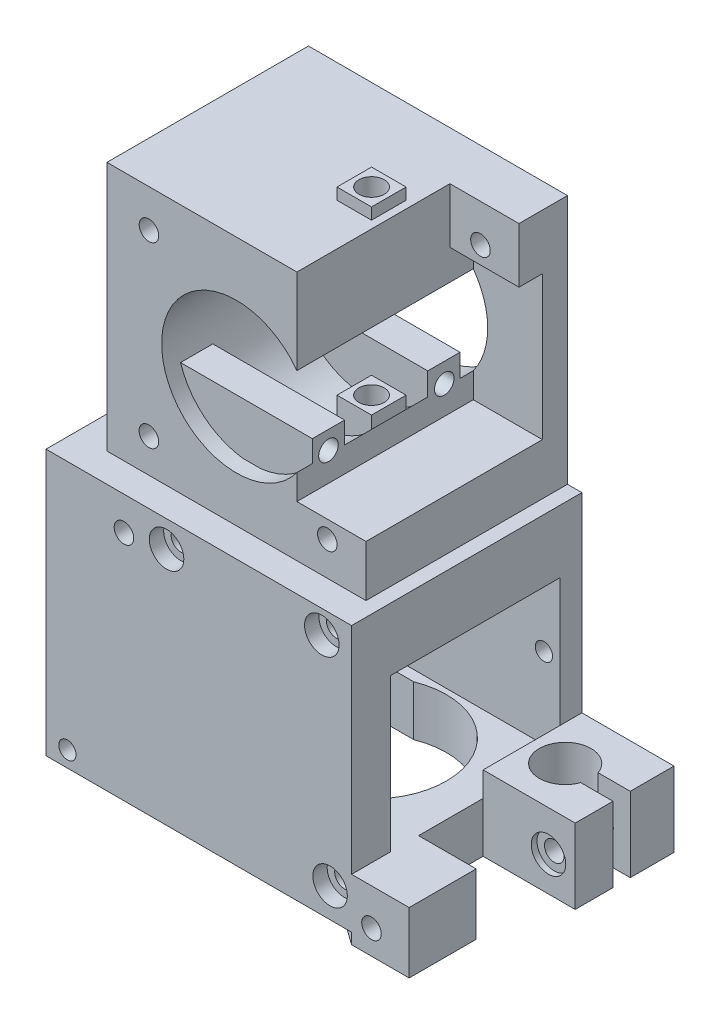
from build123d import *
from OCP.BRepAlgoAPI import BRepAlgoAPI_Cut
from OCP.TopTools import TopTools_ListOfShape

# Parameters (mm, degrees)
SKETCH1_W                     = 45
SKETCH1_H                     = 45
BOSS_EXTRUDE1_DEPTH           = 35
SKETCH2_R                     = 13
CUT_EXTRUDE3_DEPTH            = 35
SKETCH4_R                     = 1.7
CUT_EXTRUDE8_DEPTH            = 35
SKETCH7_R                     = 1.7
CUT_EXTRUDE9_DEPTH            = 35
SKETCH6_R                     = 1.7
CUT_EXTRUDE10_DEPTH           = 35
SKETCH5_R                     = 1.7
CUT_EXTRUDE11_DEPTH           = 35
CUT_EXTRUDE12_DEPTH           = 12
BOSS_EXTRUDE4_DEPTH           = 2
BOSS_EXTRUDE4_DEPTH_BACK      = 37.5
SKETCH14_W                    = 6
SKETCH14_H                    = 6
CUT_EXTRUDE17_START           = -7
SKETCH20_R                    = 2.2
CUT_EXTRUDE17_DEPTH           = 70.77141069
SKETCH21_R                    = 1.75
CUT_EXTRUDE18_DEPTH           = 2
BOSS_EXTRUDE5_DEPTH           = 44.571207257
BOSS_EXTRUDE5_DEPTH_BACK      = 1.562633388
SKETCH22_W                    = 53.082637552
SKETCH22_H                    = 40.002520942
SKETCH23_W                    = 29.449729346
SKETCH23_H                    = 26.517519529
CUT_EXTRUDE19_DEPTH           = 95.427299018
SKETCH25_R                    = 5
CUT_EXTRUDE24_DEPTH           = 2.6
SKETCH26_R                    = 8.1
CUT_EXTRUDE25_DEPTH           = 4
SKETCH27_R                    = 6.7
CUT_EXTRUDE28_DEPTH           = 6
SKETCH30_R                    = 13
CUT_EXTRUDE30_DEPTH           = 10.767560088
SKETCH31_W                    = 19.349450051
SKETCH31_H                    = 23.644133728
CUT_EXTRUDE31_DEPTH           = 9.664293754
SKETCH34_R                    = 1.5
CUT_EXTRUDE32_DEPTH           = 9
SKETCH37_W                    = 11.635024897
SKETCH37_H                    = 10.599921236
BOSS_EXTRUDE6_DEPTH           = 10
BOSS_EXTRUDE6_OTHER_WAY_DEPTH = 5
BOSS_EXTRUDE6_OTHER_WAY_TAPER = 29
SKETCH38_R                    = 1.7
CUT_EXTRUDE33_DEPTH           = 10
SKETCH39_R                    = 1.7
CUT_EXTRUDE34_DEPTH           = 88.0662855
SKETCH40_W                    = 17.159872711
SKETCH40_H                    = 13
BOSS_EXTRUDE7_DEPTH           = 16
SKETCH41_R                    = 4.5
CUT_EXTRUDE35_DEPTH           = 15
SKETCH42_W                    = 9.331425876
SKETCH42_H                    = 3
CUT_EXTRUDE36_DEPTH           = 15
CUT_EXTRUDE37_DEPTH           = 5
SKETCH44_R                    = 1.7
CUT_EXTRUDE38_DEPTH           = 23
CUT_EXTRUDE39_DEPTH           = 5
CUT_EXTRUDE40_DEPTH           = 5
CUT_EXTRUDE41_DEPTH           = 5
SKETCH53_R                    = 1.7
CUT_EXTRUDE42_DEPTH           = 90.646740997
SKETCH52_R                    = 1.7
CUT_EXTRUDE43_DEPTH           = 90.646740997
SKETCH51_R                    = 1.7
CUT_EXTRUDE44_DEPTH           = 90.646740997
CUT_EXTRUDE46_DEPTH           = 5
SKETCH57_R                    = 3
CUT_EXTRUDE48_DEPTH           = 2.5
SKETCH58_R                    = 3
CUT_EXTRUDE49_DEPTH           = 2.5
SKETCH59_R                    = 3
CUT_EXTRUDE50_DEPTH           = 2.5
SKETCH60_R                    = 3
CUT_EXTRUDE51_DEPTH           = 1
SKETCH61_W                    = 6.542017971
SKETCH61_H                    = 14.030300317
CUT_EXTRUDE52_DEPTH           = 6.5
SKETCH67_W                    = 5.604230097
SKETCH67_H                    = 8.996545788
BOSS_EXTRUDE8_DEPTH           = 33
SKETCH68_W                    = 5.604230097
SKETCH68_H                    = 9.400155495
BOSS_EXTRUDE9_DEPTH           = 33
SKETCH63_R                    = 1.7
CUT_EXTRUDE55_DEPTH           = 102.92049818
SKETCH62_R                    = 1.7
CUT_EXTRUDE56_DEPTH           = 102.92049818
SKETCH69_R                    = 3
CUT_EXTRUDE57_DEPTH           = 2.5
CUT_EXTRUDE58_DEPTH           = 2.5
SKETCH71_R                    = 3
CUT_EXTRUDE59_DEPTH           = 1
SKETCH72_R                    = 1.5
CUT_EXTRUDE60_DEPTH           = 5
SKETCH73_R                    = 1.5
CUT_EXTRUDE61_DEPTH           = 5


with BuildPart() as part:
    # Sketch1 → Boss-Extrude1 (new body)
    with BuildSketch(Plane.XY):
        Rectangle(SKETCH1_W, SKETCH1_H)
    extrude(amount=BOSS_EXTRUDE1_DEPTH)

    # Sketch2 → Cut-Extrude3 (cut)
    with BuildSketch(Plane.XY.offset(35)):
        Circle(SKETCH2_R)
    extrude(amount=-CUT_EXTRUDE3_DEPTH, mode=Mode.SUBTRACT)

    # Sketch4 → Cut-Extrude8 (cut)
    with BuildSketch(Plane(origin=(0, 0, 0), x_dir=(-1, 0, 0), z_dir=(0, 0, -1))):
        with Locations((-15.808862622, 15.928817575)):
            Circle(SKETCH4_R)
    extrude(amount=-CUT_EXTRUDE8_DEPTH, mode=Mode.SUBTRACT)

    # Sketch7 → Cut-Extrude9 (cut)
    with BuildSketch(Plane(origin=(0, 0, 0), x_dir=(-1, 0, 0), z_dir=(0, 0, -1))):
        with Locations((15.199970606, 15.923392722)):
            Circle(SKETCH7_R)
    extrude(amount=-CUT_EXTRUDE9_DEPTH, mode=Mode.SUBTRACT)

    # Sketch6 → Cut-Extrude10 (cut)
    with BuildSketch(Plane(origin=(0, 0, 0), x_dir=(-1, 0, 0), z_dir=(0, 0, -1))):
        with Locations((15.22029943, -15.065721832)):
            Circle(SKETCH6_R)
    extrude(amount=-CUT_EXTRUDE10_DEPTH, mode=Mode.SUBTRACT)

    # Sketch5 → Cut-Extrude11 (cut)
    with BuildSketch(Plane(origin=(0, 0, 0), x_dir=(-1, 0, 0), z_dir=(0, 0, -1))):
        with Locations((-15.781319068, -15.06525873)):
            Circle(SKETCH5_R)
    extrude(amount=-CUT_EXTRUDE11_DEPTH, mode=Mode.SUBTRACT)

    # Sketch8 → Cut-Extrude12 (cut)
    with BuildSketch(Plane(origin=(22.5, 0, 0), x_dir=(0, 0, -1), z_dir=(1, 0, 0))):
        Polygon((-4.363915061, -12.036124724), (-35, -12.036124724), (-35, 22.5), (-8.423058519, 22.5), (-8.423058519, 12.925541512), (-4.363915061, 12.925541512), align=None)
    extrude(amount=-CUT_EXTRUDE12_DEPTH, mode=Mode.SUBTRACT)

    # Sketch14 → Boss-Extrude4 (add, two sides: drawn at the far end of the back side and taken through both)
    with BuildSketch(Plane(origin=(0, 22.5, 0), x_dir=(1, 0, 0), z_dir=(0, 1, 0)).offset(-BOSS_EXTRUDE4_DEPTH_BACK)):
        with Locations((6.190916669, -17.729312446)):
            Rectangle(SKETCH14_W, SKETCH14_H)
    extrude(amount=BOSS_EXTRUDE4_DEPTH + BOSS_EXTRUDE4_DEPTH_BACK)

    # Sketch20 → Cut-Extrude17 (cut)
    with BuildSketch(Plane(origin=(0, 24.5, 0), x_dir=(1, 0, 0), z_dir=(0, 1, 0)).offset(CUT_EXTRUDE17_START)):
        with Locations((6.190916669, -17.729312446)):
            Circle(SKETCH20_R)
    cut_extrude17 = extrude(amount=CUT_EXTRUDE17_DEPTH, mode=Mode.SUBTRACT)

    # Sketch21 → Cut-Extrude18 (cut)
    with BuildSketch(Plane(origin=(0, 17.5, 0), x_dir=(1, 0, 0), z_dir=(0, 1, 0))):
        with Locations((6.190916669, -17.729312446)):
            Circle(SKETCH21_R)
    extrude(amount=-CUT_EXTRUDE18_DEPTH, mode=Mode.SUBTRACT)

    # Mirror6: Cut-Extrude17 across plane
    add(cut_extrude17.mirror(Plane.ZX.offset(16.5)), mode=Mode.SUBTRACT)

    # Sketch22 → Boss-Extrude5 (add, two sides: drawn at the far end of the back side and taken through both)
    with BuildSketch(Plane.XZ.offset(22.5).offset(-BOSS_EXTRUDE5_DEPTH_BACK)):
        with Locations((-1.541318776, 20.001258793)):
            Rectangle(SKETCH22_W, SKETCH22_H)
    extrude(amount=BOSS_EXTRUDE5_DEPTH + BOSS_EXTRUDE5_DEPTH_BACK)

    # Sketch23 → Cut-Extrude19 (cut, through all)
    with BuildSketch(Plane.ZY.offset(28.082637552)):
        with Locations((18.529138975, -45.100264067)):
            Rectangle(SKETCH23_W, SKETCH23_H)
    extrude(amount=-CUT_EXTRUDE19_DEPTH, mode=Mode.SUBTRACT)

    # Sketch25 → Cut-Extrude24 (cut)
    with BuildSketch(Plane(origin=(0, -20.937366612, 0), x_dir=(1, 0, 0), z_dir=(0, 1, 0))):
        with Locations((6.190916669, -17.729312446)):
            Circle(SKETCH25_R)
    extrude(amount=-CUT_EXTRUDE24_DEPTH, mode=Mode.SUBTRACT)

    # Sketch26 → Cut-Extrude25 (cut)
    with BuildSketch(Plane(origin=(0, -23.537366612, 0), x_dir=(1, 0, 0), z_dir=(0, 1, 0))):
        with Locations((6.190916669, -17.729312446)):
            Circle(SKETCH26_R)
    extrude(amount=-CUT_EXTRUDE25_DEPTH, mode=Mode.SUBTRACT)

    # Sketch27 → Cut-Extrude28 (cut)
    with BuildSketch(Plane(origin=(0, -27.537366612, 0), x_dir=(1, 0, 0), z_dir=(0, 1, 0))):
        with Locations((6.190916669, -17.729312446)):
            Circle(SKETCH27_R)
    extrude(amount=-CUT_EXTRUDE28_DEPTH, mode=Mode.SUBTRACT)

    # Sketch30 → Cut-Extrude30 (cut)
    with BuildSketch(Plane(origin=(0, -58.359023831, 0), x_dir=(1, 0, 0), z_dir=(0, 1, 0))):
        with Locations((6.207851035, -17.729312446)):
            Circle(SKETCH30_R)
    extrude(amount=-CUT_EXTRUDE30_DEPTH, mode=Mode.SUBTRACT)

    # Sketch31 → Cut-Extrude31 (cut)
    with BuildSketch(Plane.XZ.offset(67.071207257)):
        with Locations((-7.592166715, 17.462222744)):
            Rectangle(SKETCH31_W, SKETCH31_H)
    extrude(amount=-CUT_EXTRUDE31_DEPTH, mode=Mode.SUBTRACT)

    # Sketch34 → Cut-Extrude32 (cut)
    with BuildSketch(Plane.ZY.offset(28.082637552)):
        with Locations((35.530918006, -28.494957131)):
            Circle(SKETCH34_R)
        with Locations((3.530918006, -28.494957131)):
            Circle(SKETCH34_R)
        with Locations((35.530918006, -60.494957131)):
            Circle(SKETCH34_R)
        with Locations((3.530918006, -60.494957131)):
            Circle(SKETCH34_R)
    extrude(amount=-CUT_EXTRUDE32_DEPTH, mode=Mode.SUBTRACT)

    # Sketch37 → Boss-Extrude6 (add)
    with BuildSketch(Plane(origin=(25, 0, 0), x_dir=(0, 0, -1), z_dir=(1, 0, 0))):
        with Locations((-34.185004037, -63.658986353)):
            Rectangle(SKETCH37_W, SKETCH37_H)
    extrude(amount=BOSS_EXTRUDE6_DEPTH)

    # Sketch37 → Boss-Extrude6 other way (add)
    with BuildSketch(Plane(origin=(25, 0, 0), x_dir=(0, 0, -1), z_dir=(1, 0, 0))):
        with Locations((-34.185004037, -63.658986353)):
            Rectangle(SKETCH37_W, SKETCH37_H)
    extrude(amount=-BOSS_EXTRUDE6_OTHER_WAY_DEPTH, taper=BOSS_EXTRUDE6_OTHER_WAY_TAPER)

    # Sketch38 → Cut-Extrude33 (cut)
    with BuildSketch(Plane.XY.offset(40.002519264)):
        with Locations((28.454234577, -64.748396148)):
            Circle(SKETCH38_R)
    extrude(amount=-CUT_EXTRUDE33_DEPTH, mode=Mode.SUBTRACT)

    # Sketch39 → Cut-Extrude34 (cut, through all)
    with BuildSketch(Plane.XY.offset(40.002519264)):
        with Locations((-14.545765423, -26.748396148)):
            Circle(SKETCH39_R)
    extrude(amount=-CUT_EXTRUDE34_DEPTH, mode=Mode.SUBTRACT)

    # Sketch40 → Boss-Extrude7 (add)
    with BuildSketch(Plane(origin=(25, 0, 0), x_dir=(0, 0, -1), z_dir=(1, 0, 0))):
        with Locations((-8.579933523, -60.571207257)):
            Rectangle(SKETCH40_W, SKETCH40_H)
    extrude(amount=BOSS_EXTRUDE7_DEPTH)

    # Sketch41 → Cut-Extrude35 (cut)
    with BuildSketch(Plane(origin=(0, -54.071207257, 1.269334023), x_dir=(1, 0, 0), z_dir=(0, 1, 0))):
        with Locations((31.163890056, -7.793414205)):
            Circle(SKETCH41_R)
    extrude(amount=-CUT_EXTRUDE35_DEPTH, mode=Mode.SUBTRACT)

    # Sketch42 → Cut-Extrude36 (cut)
    with BuildSketch(Plane(origin=(0, -54.071207257, 0), x_dir=(1, 0, 0), z_dir=(0, 1, 0))):
        with Locations((38.19390682, -9.095710432)):
            Rectangle(SKETCH42_W, SKETCH42_H)
    extrude(amount=-CUT_EXTRUDE36_DEPTH, mode=Mode.SUBTRACT)


with BuildPart() as cut_extrude37_tool:
    # Sketch43 → Cut-Extrude37 (new body)
    with BuildSketch(Plane(origin=(0, 0, 0), x_dir=(-1, 0, 0), z_dir=(0, 0, -1))):
        Polygon((-34.628927379, -64.403909926), (-32.738460245, -61.095415705), (-34.658466721, -57.80397603), (-38.468940333, -57.821030577), (-40.359407467, -61.129524799), (-38.439400991, -64.420964473), align=None)
    extrude(amount=-CUT_EXTRUDE37_DEPTH)


with BuildPart() as part_1:
    add(part.part)

    # Cut-Extrude37: cut by cut_extrude37_tool, with a tolerance
    cut_extrude37_stock = TopTools_ListOfShape()
    cut_extrude37_stock.Append(part_1.part.wrapped)
    cut_extrude37_tools = TopTools_ListOfShape()
    cut_extrude37_tools.Append(cut_extrude37_tool.part.wrapped)
    cut_extrude37_cut = BRepAlgoAPI_Cut()
    cut_extrude37_cut.SetArguments(cut_extrude37_stock)
    cut_extrude37_cut.SetTools(cut_extrude37_tools)
    cut_extrude37_cut.SetFuzzyValue(0.00001)
    cut_extrude37_cut.Build()
    add(Compound.cast(cut_extrude37_cut.Shape()).solids(), mode=Mode.REPLACE)

    # Sketch44 → Cut-Extrude38 (cut)
    with BuildSketch(Plane.XY.offset(17.159869878)):
        with Locations((36.360549159, -61.087091915)):
            Circle(SKETCH44_R)
    extrude(amount=-CUT_EXTRUDE38_DEPTH, mode=Mode.SUBTRACT)


with BuildPart() as cut_extrude39_tool:
    # Sketch48 → Cut-Extrude39 (new body)
    with BuildSketch(Plane(origin=(0, 0, 0), x_dir=(-1, 0, 0), z_dir=(0, 0, -1))):
        Polygon((9.066729233, -28.811078933), (10.957196368, -25.502584711), (9.037189891, -22.211145037), (5.22671628, -22.228199584), (3.336249145, -25.536693806), (5.256255622, -28.82813348), align=None)
    extrude(amount=-CUT_EXTRUDE39_DEPTH)


with BuildPart() as part_2:
    add(part_1.part)

    # Cut-Extrude39: cut by cut_extrude39_tool, with a tolerance
    cut_extrude39_stock = TopTools_ListOfShape()
    cut_extrude39_stock.Append(part_2.part.wrapped)
    cut_extrude39_tools = TopTools_ListOfShape()
    cut_extrude39_tools.Append(cut_extrude39_tool.part.wrapped)
    cut_extrude39_cut = BRepAlgoAPI_Cut()
    cut_extrude39_cut.SetArguments(cut_extrude39_stock)
    cut_extrude39_cut.SetTools(cut_extrude39_tools)
    cut_extrude39_cut.SetFuzzyValue(0.00001)
    cut_extrude39_cut.Build()
    add(Compound.cast(cut_extrude39_cut.Shape()).solids(), mode=Mode.REPLACE)


with BuildPart() as cut_extrude40_tool:
    # Sketch49 → Cut-Extrude40 (new body)
    with BuildSketch(Plane(origin=(0, 0, 0), x_dir=(-1, 0, 0), z_dir=(0, 0, -1))):
        Polygon((-19.339505263, -65.26594849), (-17.449038128, -61.957454268), (-19.369044605, -58.666014594), (-23.179518216, -58.683069141), (-25.06998535, -61.991563363), (-23.149978874, -65.283003037), align=None)
    extrude(amount=-CUT_EXTRUDE40_DEPTH)


with BuildPart() as part_3:
    add(part_2.part)

    # Cut-Extrude40: cut by cut_extrude40_tool, with a tolerance
    cut_extrude40_stock = TopTools_ListOfShape()
    cut_extrude40_stock.Append(part_3.part.wrapped)
    cut_extrude40_tools = TopTools_ListOfShape()
    cut_extrude40_tools.Append(cut_extrude40_tool.part.wrapped)
    cut_extrude40_cut = BRepAlgoAPI_Cut()
    cut_extrude40_cut.SetArguments(cut_extrude40_stock)
    cut_extrude40_cut.SetTools(cut_extrude40_tools)
    cut_extrude40_cut.SetFuzzyValue(0.00001)
    cut_extrude40_cut.Build()
    add(Compound.cast(cut_extrude40_cut.Shape()).solids(), mode=Mode.REPLACE)


with BuildPart() as cut_extrude41_tool:
    # Sketch50 → Cut-Extrude41 (new body)
    with BuildSketch(Plane(origin=(0, 0, 0), x_dir=(-1, 0, 0), z_dir=(0, 0, -1))):
        Polygon((-17.911640095, -28.243498116), (-16.02117296, -24.935003895), (-17.941179437, -21.64356422), (-21.751653048, -21.660618767), (-23.642120183, -24.969112989), (-21.722113706, -28.260552663), align=None)
    extrude(amount=-CUT_EXTRUDE41_DEPTH)


with BuildPart() as part_4:
    add(part_3.part)

    # Cut-Extrude41: cut by cut_extrude41_tool, with a tolerance
    cut_extrude41_stock = TopTools_ListOfShape()
    cut_extrude41_stock.Append(part_4.part.wrapped)
    cut_extrude41_tools = TopTools_ListOfShape()
    cut_extrude41_tools.Append(cut_extrude41_tool.part.wrapped)
    cut_extrude41_cut = BRepAlgoAPI_Cut()
    cut_extrude41_cut.SetArguments(cut_extrude41_stock)
    cut_extrude41_cut.SetTools(cut_extrude41_tools)
    cut_extrude41_cut.SetFuzzyValue(0.00001)
    cut_extrude41_cut.Build()
    add(Compound.cast(cut_extrude41_cut.Shape()).solids(), mode=Mode.REPLACE)

    # Sketch53 → Cut-Extrude42 (cut, through all)
    with BuildSketch(Plane.XY.offset(40.002519264)):
        with Locations((21.259511739, -61.974508816)):
            Circle(SKETCH53_R)
    extrude(amount=-CUT_EXTRUDE42_DEPTH, mode=Mode.SUBTRACT)

    # Sketch52 → Cut-Extrude43 (cut, through all)
    with BuildSketch(Plane.XY.offset(40.002519264)):
        with Locations((19.831646572, -24.952058442)):
            Circle(SKETCH52_R)
    extrude(amount=-CUT_EXTRUDE43_DEPTH, mode=Mode.SUBTRACT)

    # Sketch51 → Cut-Extrude44 (cut, through all)
    with BuildSketch(Plane.XY.offset(40.002519264)):
        with Locations((-7.146722757, -25.519639258)):
            Circle(SKETCH51_R)
    extrude(amount=-CUT_EXTRUDE44_DEPTH, mode=Mode.SUBTRACT)


with BuildPart() as cut_extrude46_tool:
    # Sketch55 → Cut-Extrude46 (new body)
    with BuildSketch(Plane(origin=(0, 0, 0), x_dir=(-1, 0, 0), z_dir=(0, 0, -1))):
        Polygon((16.584868726, -29.967411171), (18.35306586, -26.591988399), (16.313962558, -23.372973375), (12.506662121, -23.529381124), (10.738464986, -26.904803896), (12.777568289, -30.12381892), align=None)
    extrude(amount=-CUT_EXTRUDE46_DEPTH)


with BuildPart() as part_5:
    add(part_4.part)

    # Cut-Extrude46: cut by cut_extrude46_tool, with a tolerance
    cut_extrude46_stock = TopTools_ListOfShape()
    cut_extrude46_stock.Append(part_5.part.wrapped)
    cut_extrude46_tools = TopTools_ListOfShape()
    cut_extrude46_tools.Append(cut_extrude46_tool.part.wrapped)
    cut_extrude46_cut = BRepAlgoAPI_Cut()
    cut_extrude46_cut.SetArguments(cut_extrude46_stock)
    cut_extrude46_cut.SetTools(cut_extrude46_tools)
    cut_extrude46_cut.SetFuzzyValue(0.00001)
    cut_extrude46_cut.Build()
    add(Compound.cast(cut_extrude46_cut.Shape()).solids(), mode=Mode.REPLACE)

    # Sketch57 → Cut-Extrude48 (cut)
    with BuildSketch(Plane.XY.offset(40.002519264)):
        with Locations((-7.146722757, -25.519639258)):
            Circle(SKETCH57_R)
    extrude(amount=-CUT_EXTRUDE48_DEPTH, mode=Mode.SUBTRACT)

    # Sketch58 → Cut-Extrude49 (cut)
    with BuildSketch(Plane.XY.offset(40.002519264)):
        with Locations((19.831646572, -24.952058442)):
            Circle(SKETCH58_R)
    extrude(amount=-CUT_EXTRUDE49_DEPTH, mode=Mode.SUBTRACT)

    # Sketch59 → Cut-Extrude50 (cut)
    with BuildSketch(Plane.XY.offset(40.002519264)):
        with Locations((21.259511739, -61.974508816)):
            Circle(SKETCH59_R)
    extrude(amount=-CUT_EXTRUDE50_DEPTH, mode=Mode.SUBTRACT)

    # Sketch60 → Cut-Extrude51 (cut)
    with BuildSketch(Plane(origin=(0, 0, 0), x_dir=(-1, 0, 0), z_dir=(0, 0, -1))):
        with Locations((-15.808862622, 15.928817575)):
            Circle(SKETCH60_R)
        with Locations((15.199970606, 15.923392722)):
            Circle(SKETCH60_R)
        with Locations((-15.781319068, -15.06525873)):
            Circle(SKETCH60_R)
        with Locations((15.22029943, -15.065721832)):
            Circle(SKETCH60_R)
    extrude(amount=-CUT_EXTRUDE51_DEPTH, mode=Mode.SUBTRACT)

    # Sketch61 → Cut-Extrude52 (cut)
    with BuildSketch(Plane(origin=(9.190916669, 0, 0), x_dir=(0, 0, -1), z_dir=(1, 0, 0))):
        with Locations((-17.812553374, 0.202623489)):
            Rectangle(SKETCH61_W, SKETCH61_H)
    extrude(amount=-CUT_EXTRUDE52_DEPTH, mode=Mode.SUBTRACT)

    # Sketch67 → Boss-Extrude8 (add)
    with BuildSketch(Plane(origin=(-22.5, -2.468350024, 0), x_dir=(0, 0, 1), z_dir=(-1, 0, 0))):
        with Locations((29.51622543, -5.940778019)):
            Rectangle(SKETCH67_W, SKETCH67_H)
    extrude(amount=-BOSS_EXTRUDE8_DEPTH)

    # Sketch68 → Boss-Extrude9 (add)
    with BuildSketch(Plane(origin=(-22.5, -2.468350024, 0), x_dir=(0, 0, 1), z_dir=(-1, 0, 0))):
        with Locations((9.47264346, -5.966332429)):
            Rectangle(SKETCH68_W, SKETCH68_H)
    extrude(amount=-BOSS_EXTRUDE9_DEPTH)

    # Sketch63 → Cut-Extrude55 (cut, through all)
    with BuildSketch(Plane.ZY.offset(22.5)):
        with Locations((29.516225429, -7.068802512)):
            Circle(SKETCH63_R)
    extrude(amount=-CUT_EXTRUDE55_DEPTH, mode=Mode.SUBTRACT)

    # Sketch62 → Cut-Extrude56 (cut, through all)
    with BuildSketch(Plane.ZY.offset(22.5)):
        with Locations((9.403782955, -7.127149089)):
            Circle(SKETCH62_R)
    extrude(amount=-CUT_EXTRUDE56_DEPTH, mode=Mode.SUBTRACT)

    # Sketch69 → Cut-Extrude57 (cut)
    with BuildSketch(Plane.ZY.offset(22.5)):
        with Locations((9.403782955, -7.127149089)):
            Circle(SKETCH69_R)
        with Locations((29.516225429, -7.068802512)):
            Circle(SKETCH69_R)
    extrude(amount=-CUT_EXTRUDE57_DEPTH, mode=Mode.SUBTRACT)

    # Sketch70 → Cut-Extrude58 (cut)
    with BuildSketch(Plane(origin=(0, 0, 28.367491588), x_dir=(-1, 0, 0), z_dir=(0, 0, -1))):
        Polygon((-25.203073509, -66.735844691), (-25.107473116, -62.926532343), (-28.358634183, -60.9390838), (-31.705395644, -62.760947604), (-31.800996038, -66.570259952), (-28.54983497, -68.557708496), align=None)
    extrude(amount=-CUT_EXTRUDE58_DEPTH, mode=Mode.SUBTRACT)

    # Sketch71 → Cut-Extrude59 (cut)
    with BuildSketch(Plane.XY.offset(17.159869878)):
        with Locations((36.360549159, -61.087091915)):
            Circle(SKETCH71_R)
    extrude(amount=-CUT_EXTRUDE59_DEPTH, mode=Mode.SUBTRACT)


with BuildPart() as cut_extrude60_tool:
    # Sketch72 → Cut-Extrude60 (new body)
    with BuildSketch(Plane(origin=(0, 0, 0), x_dir=(-1, 0, 0), z_dir=(0, 0, -1))):
        with Locations((-22.210039472, -44.316669137)):
            Circle(SKETCH72_R)
        with Locations((-8.210039472, -44.316669137)):
            Circle(SKETCH72_R)
        with Locations((20.289960528, -53.116669137)):
            Circle(SKETCH72_R)
        with Locations((2.789960528, -34.216669137)):
            Circle(SKETCH72_R)
    extrude(amount=-CUT_EXTRUDE60_DEPTH)


with BuildPart() as part_6:
    add(part_5.part)

    # Cut-Extrude60: cut by cut_extrude60_tool, with a tolerance
    cut_extrude60_stock = TopTools_ListOfShape()
    cut_extrude60_stock.Append(part_6.part.wrapped)
    cut_extrude60_tools = TopTools_ListOfShape()
    cut_extrude60_tools.Append(cut_extrude60_tool.part.wrapped)
    cut_extrude60_cut = BRepAlgoAPI_Cut()
    cut_extrude60_cut.SetArguments(cut_extrude60_stock)
    cut_extrude60_cut.SetTools(cut_extrude60_tools)
    cut_extrude60_cut.SetFuzzyValue(0.00001)
    cut_extrude60_cut.Build()
    add(Compound.cast(cut_extrude60_cut.Shape()).solids(), mode=Mode.REPLACE)

    # Sketch73 → Cut-Extrude61 (cut)
    with BuildSketch(Plane.XY.offset(40.002519264)):
        with Locations((-24.369276222, -64.32278971)):
            Circle(SKETCH73_R)
    extrude(amount=-CUT_EXTRUDE61_DEPTH, mode=Mode.SUBTRACT)


solid = part_6.part
